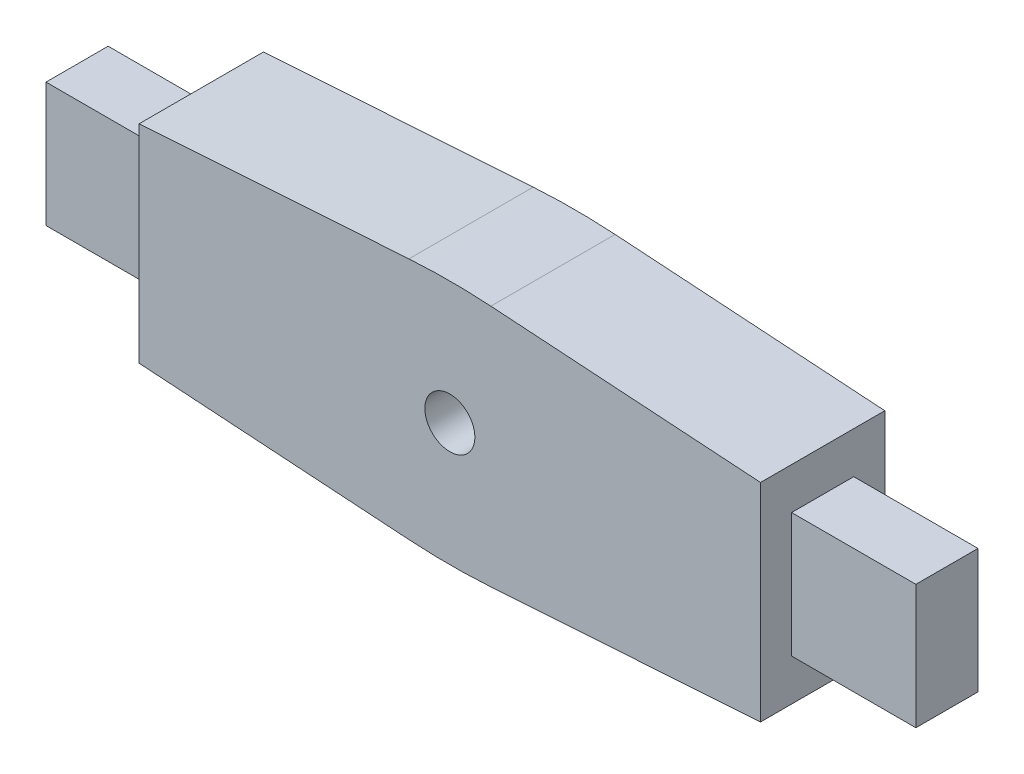
from build123d import *

# Parameters (mm, degrees)
SKETCH1_R           = 4.025
BOSS_EXTRUDE1_DEPTH = 20
FILLET1_R           = 100
SKETCH2_W           = 10
SKETCH2_H           = 20
BOSS_EXTRUDE2_DEPTH = 20


with BuildPart() as part:
    # Sketch1 → Boss-Extrude1 (new body)
    with BuildSketch(Plane.XY):
        Polygon((50, 16.695671227), (50, -16.695671227), (0, -20), (-50, -16.695671227), (-50, 16.695671227), (0, 20), align=None)
        Circle(SKETCH1_R, mode=Mode.SUBTRACT)
    extrude(amount=BOSS_EXTRUDE1_DEPTH)

    # Fillet1
    fillet1_edges = [part.edges().sort_by_distance(p)[0] for p in [
        (0, 20, 10),
        (0, -20, 10),
    ]]
    fillet(fillet1_edges, radius=FILLET1_R)

    # Sketch2 → Boss-Extrude2 (add)
    with BuildSketch(Plane(origin=(50, 0, 0), x_dir=(0, 0, -1), z_dir=(1, 0, 0))):
        with Locations((-10, 0)):
            Rectangle(SKETCH2_W, SKETCH2_H)
    boss_extrude2 = extrude(amount=BOSS_EXTRUDE2_DEPTH)

    # Mirror1: Boss-Extrude2 across plane
    add(boss_extrude2.mirror(Plane(origin=(0, 0, 0), x_dir=(0, 0, 1), z_dir=(1, 0, 0))))


solid = part.part
